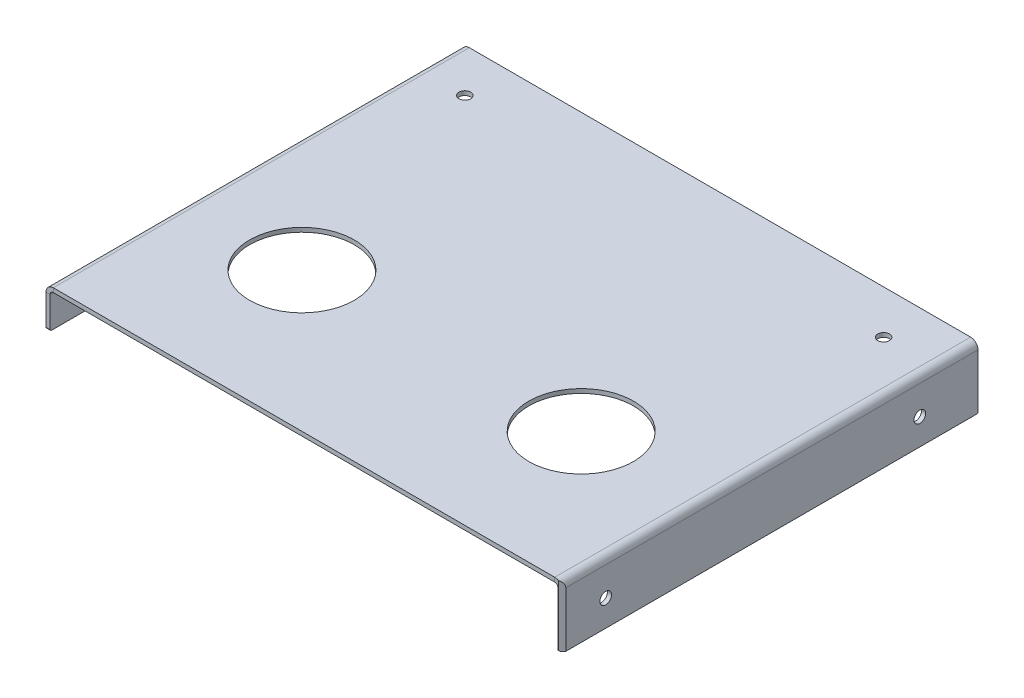
from build123d import *

# Parameters (mm, degrees)
BASE_FLANGE1_DEPTH = 227.0252
CUT_EXTRUDE1_REACH = 271.924
SKETCH2_R          = 28.575
SKETCH2_R_2        = 3.175
SKETCH3_R          = 3.175
CUT_EXTRUDE2_DEPTH = 7.62
FILLET1_R          = 0.762
CUT_EXTRUDE3_DEPTH = 270.923905809


# Sheet-metal steps are written as plain solids
with BuildPart() as part:
    # Sketch1 → Base-Flange1 (new body)
    with BuildSketch(Plane(origin=(0, 0, 0), x_dir=(-1, 0, 0), z_dir=(0, 0, -1))):
        with BuildLine():
            Line((-139.7, -31.75), (-139.7, -1.7272))
            ThreePointArc((-139.7, -1.7272), (-139.194114832, -0.505885168), (-137.9728, 0))
            Line((-137.9728, 0), (135.6868, 0))
            ThreePointArc((135.6868, 0), (136.908114832, -0.505885168), (137.414, -1.7272))
            Line((137.414, -1.7272), (137.414, -19.05))
            Line((137.414, -19.05), (139.7, -19.05))
            Line((139.7, -19.05), (139.7, -1.7272))
            ThreePointArc((139.7, -1.7272), (138.524560934, 1.110560934), (135.6868, 2.286))
            Line((135.6868, 2.286), (-137.9728, 2.286))
            ThreePointArc((-137.9728, 2.286), (-140.810560934, 1.110560934), (-141.986, -1.7272))
            Line((-141.986, -1.7272), (-141.986, -31.75))
            Line((-141.986, -31.75), (-139.7, -31.75))
        make_face()
    extrude(amount=BASE_FLANGE1_DEPTH)

    # Sketch2 → Cut-Extrude1 (cut, up to next)
    with BuildSketch(Plane(origin=(0, 2.286, 0), x_dir=(1, 0, 0), z_dir=(0, 1, 0)), mode=Mode.PRIVATE) as cut_extrude1_sk1:
        with Locations(Location((-76.2, 76.2, 0), (0, 0, 270))):
            Circle(SKETCH2_R)
    cut_extrude1_tool1 = extrude(cut_extrude1_sk1.sketch, amount=-CUT_EXTRUDE1_REACH, mode=Mode.PRIVATE) & part.part
    # Sketch2 → Cut-Extrude1 (cut, up to next)
    with BuildSketch(Plane(origin=(0, 2.286, 0), x_dir=(1, 0, 0), z_dir=(0, 1, 0)), mode=Mode.PRIVATE) as cut_extrude1_sk2:
        with Locations(Location((76.2, 76.2, 0), (0, 0, 270))):
            Circle(SKETCH2_R)
    cut_extrude1_tool2 = extrude(cut_extrude1_sk2.sketch, amount=-CUT_EXTRUDE1_REACH, mode=Mode.PRIVATE) & part.part
    # Sketch2 → Cut-Extrude1 (cut, up to next)
    with BuildSketch(Plane(origin=(0, 2.286, 0), x_dir=(1, 0, 0), z_dir=(0, 1, 0)), mode=Mode.PRIVATE) as cut_extrude1_sk3:
        with Locations(Location((114.3, 203.2, 0), (0, 0, 270))):
            Circle(SKETCH2_R_2)
    cut_extrude1_tool3 = extrude(cut_extrude1_sk3.sketch, amount=-CUT_EXTRUDE1_REACH, mode=Mode.PRIVATE) & part.part
    # Sketch2 → Cut-Extrude1 (cut, up to next)
    with BuildSketch(Plane(origin=(0, 2.286, 0), x_dir=(1, 0, 0), z_dir=(0, 1, 0)), mode=Mode.PRIVATE) as cut_extrude1_sk4:
        with Locations(Location((-114.3, 203.2, 0), (0, 0, 270))):
            Circle(SKETCH2_R_2)
    cut_extrude1_tool4 = extrude(cut_extrude1_sk4.sketch, amount=-CUT_EXTRUDE1_REACH, mode=Mode.PRIVATE) & part.part
    add(cut_extrude1_tool1.solids().sort_by_distance((-76.2, 2.286, -76.2))[0], mode=Mode.SUBTRACT)
    add(cut_extrude1_tool2.solids().sort_by_distance((76.2, 2.286, -76.2))[0], mode=Mode.SUBTRACT)
    add(cut_extrude1_tool3.solids().sort_by_distance((114.3, 2.286, -203.2))[0], mode=Mode.SUBTRACT)
    add(cut_extrude1_tool4.solids().sort_by_distance((-114.3, 2.286, -203.2))[0], mode=Mode.SUBTRACT)

    # Sketch3 → Cut-Extrude2 (cut)
    with BuildSketch(Plane(origin=(141.986, 0, 0), x_dir=(0, 0, -1), z_dir=(1, 0, 0))):
        with Locations((23.8252, -17.4752)):
            Circle(SKETCH3_R)
        with Locations((195.2752, -17.4752)):
            Circle(SKETCH3_R)
    extrude(amount=-CUT_EXTRUDE2_DEPTH, mode=Mode.SUBTRACT)

    # Fillet1
    fillet1_edges = [part.edges().sort_by_distance(p)[0] for p in [
        (140.843, -31.75, 0),
        (-138.557, -19.05, 0),
        (140.843, -31.75, -227.0252),
        (-138.557, -19.05, -227.0252),
    ]]
    fillet(fillet1_edges, radius=FILLET1_R)

    # Sketch4 → Cut-Extrude3 (cut, through all)
    with BuildSketch(Plane(origin=(0, 2.286, 0), x_dir=(1, 0, 0), z_dir=(0, 1, 0))):
        Polygon((150.619782866, 10.665476011), (128.807714722, -11.146592133), (150.619782866, -11.146592133), align=None)
    extrude(amount=-CUT_EXTRUDE3_DEPTH, mode=Mode.SUBTRACT)


solid = part.part
